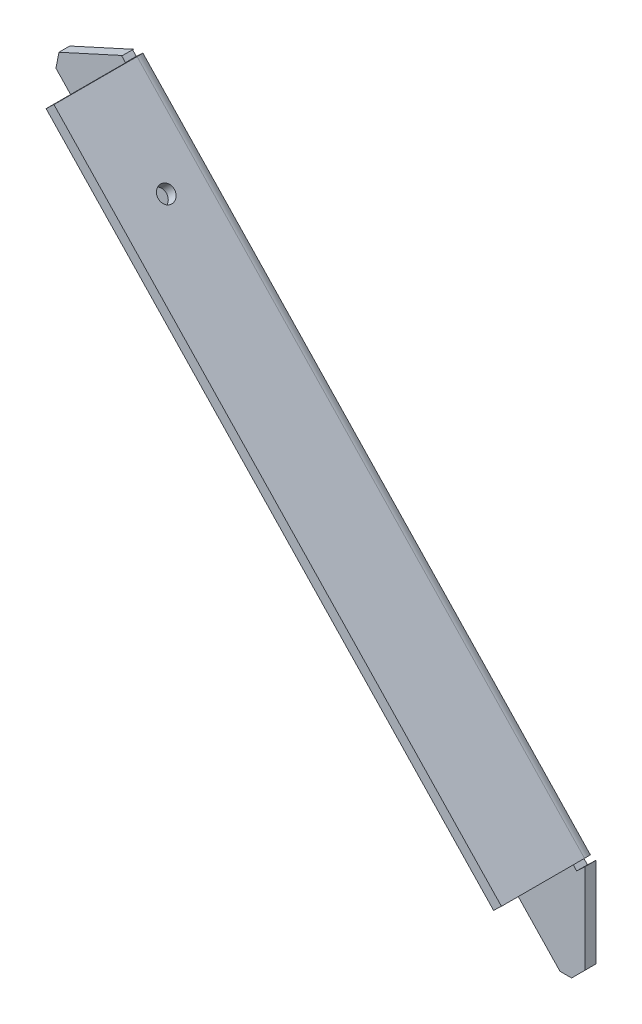
from build123d import *

# Parameters (mm, degrees)
BASE_FLANGE1_DEPTH            = 4
EDGE_FLANGE1_STRIP_W          = 16.4
EDGE_FLANGE1_STRIP_H          = 4
EDGE_FLANGE1_STRIP_CUT_DEPTH  = 240.587208925
EDGE_FLANGE1_RELIEF_W         = 18.4
EDGE_FLANGE1_RELIEF_H         = 2
EDGE_FLANGE1_RELIEF_CUT_DEPTH = 4
EDGE_FLANGE1_DEPTH            = 240.587208925
SKETCH9_R                     = 3
CUT_EXTRUDE1_DEPTH            = 10


# Sheet-metal steps are written as plain solids
with BuildPart() as part:
    # Sketch1 → Base-Flange1 (new body)
    with BuildSketch(Plane.XY):
        Polygon((88.217940857, -94.952805993), (-98.507333634, 101.415804733), (-97.402972414, 107.112654424), (-68.257223266, 120.395137548), (97.52878242, -53.952805993), (97.52878242, -89.952805993), (92.52878242, -94.952805993), align=None)
    extrude(amount=-BASE_FLANGE1_DEPTH)

    # Edge-Flange1 strip (across the edge) → Edge-Flange1 strip cut (cut)
    with BuildSketch(Plane(origin=(97.52878242, -53.952805993, 0), x_dir=(-0.7246766954889595, -0.689089026915392, 3.4914813388431334e-15), z_dir=(-0.689089026915392, 0.7246766954889595, 0))):
        with Locations((-4, -2)):
            Rectangle(EDGE_FLANGE1_STRIP_W, EDGE_FLANGE1_STRIP_H)
    extrude(amount=EDGE_FLANGE1_STRIP_CUT_DEPTH, mode=Mode.SUBTRACT)

    # Edge-Flange1 relief (on the sheet) → Edge-Flange1 relief cut (cut)
    with BuildSketch(Plane(origin=(94.485140299, -56.846979906, 0), x_dir=(-0.7246766954889595, -0.689089026915392, 6.982962677686267e-15), z_dir=(0, 0, 1))):
        with Locations((-7.2, 1)):
            Rectangle(EDGE_FLANGE1_RELIEF_W, EDGE_FLANGE1_RELIEF_H)
        with Locations((-7.2, -241.587208925)):
            Rectangle(EDGE_FLANGE1_RELIEF_W, EDGE_FLANGE1_RELIEF_H)
    extrude(amount=-EDGE_FLANGE1_RELIEF_CUT_DEPTH, mode=Mode.SUBTRACT)

    # Edge-Flange1 section (across the edge) → Edge-Flange1 (add)
    with BuildSketch(Plane(origin=(97.52878242, -53.952805993, 0), x_dir=(-0.7246766954889595, -0.689089026915392, 3.4914813388431334e-15), z_dir=(-0.689089026915392, 0.7246766954889595, 0))):
        with BuildLine():
            Line((0, 0.2), (0, 31))
            Line((0, 31), (4, 31))
            Line((4, 31), (4, 0.2))
            ThreePointArc((4, 0.2), (4.058578644, 0.058578644), (4.2, 0))
            Line((4.2, 0), (4.2, -4))
            ThreePointArc((4.2, -4), (1.230151519, -2.769848481), (0, 0.2))
        make_face()
    extrude(amount=EDGE_FLANGE1_DEPTH)

    # Sketch9 → Cut-Extrude1 (cut)
    with BuildSketch(Plane(origin=(24.275617922, 23.083482656, 0), x_dir=(0, 0, -1), z_dir=(0.7246766954889596, 0.689089026915392, -3.4889229979583694e-15))):
        with Locations(Location((-13.5, 99.282853991, 0), (0, 0, 90))):
            Circle(SKETCH9_R)
    extrude(amount=-CUT_EXTRUDE1_DEPTH, mode=Mode.SUBTRACT)


solid = part.part
